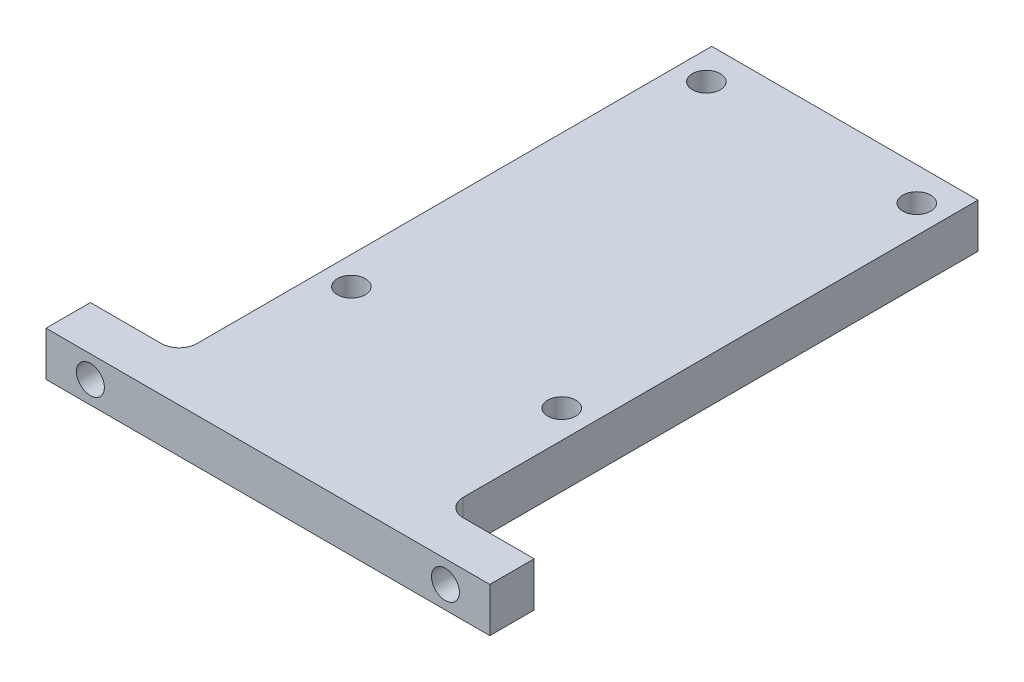
from build123d import *

# Parameters (mm, degrees)
BOSS_EXTRUDE1_DEPTH     = 6.35
CUT_EXTRUDE1_DEPTH      = 105.341147205
CUT_EXTRUDE1_DEPTH_BACK = 105.341147205
SKETCH2_R               = 2
CUT_EXTRUDE2_DEPTH      = 105.341147205
CUT_EXTRUDE2_DEPTH_BACK = 105.341147205
SKETCH3_R               = 2
FILLET1_R               = 2.54


with BuildPart() as part:
    # Sketch1 → Boss-Extrude1 (new body)
    with BuildSketch(Plane(origin=(0, 0, 0), x_dir=(1, 0, 0), z_dir=(0, 1, 0))):
        Polygon((0, 0), (63.5, 0), (63.5, 6.35), (50.8, 6.35), (50.8, 82.55), (12.7, 82.55), (12.7, 6.35), (0, 6.35), align=None)
    extrude(amount=BOSS_EXTRUDE1_DEPTH)

    # Sketch2 → Cut-Extrude1 (cut, two sides: drawn at the far end of the back side and taken through both)
    with BuildSketch(Plane.XY.offset(-CUT_EXTRUDE1_DEPTH_BACK)):
        with Locations((6.35, 3.175)):
            Circle(SKETCH2_R)
        with Locations((57.15, 3.175)):
            Circle(SKETCH2_R)
    extrude(amount=CUT_EXTRUDE1_DEPTH + CUT_EXTRUDE1_DEPTH_BACK, mode=Mode.SUBTRACT)

    # Sketch3 → Cut-Extrude2 (cut, two sides: drawn at the far end of the back side and taken through both)
    with BuildSketch(Plane(origin=(0, 6.35, 0), x_dir=(1, 0, 0), z_dir=(0, 1, 0)).offset(-CUT_EXTRUDE2_DEPTH_BACK)):
        with Locations((46.8, 77.7875)):
            Circle(SKETCH3_R)
        with Locations((16.7, 77.7875)):
            Circle(SKETCH3_R)
        with Locations((16.7, 26.9875)):
            Circle(SKETCH3_R)
        with Locations((46.8, 26.9875)):
            Circle(SKETCH3_R)
    extrude(amount=CUT_EXTRUDE2_DEPTH + CUT_EXTRUDE2_DEPTH_BACK, mode=Mode.SUBTRACT)

    # Fillet1
    fillet1_edges = [part.edges().sort_by_distance(p)[0] for p in [
        (12.7, 3.175, -6.35),
        (50.8, 3.175, -6.35),
    ]]
    fillet(fillet1_edges, radius=FILLET1_R)


solid = part.part
